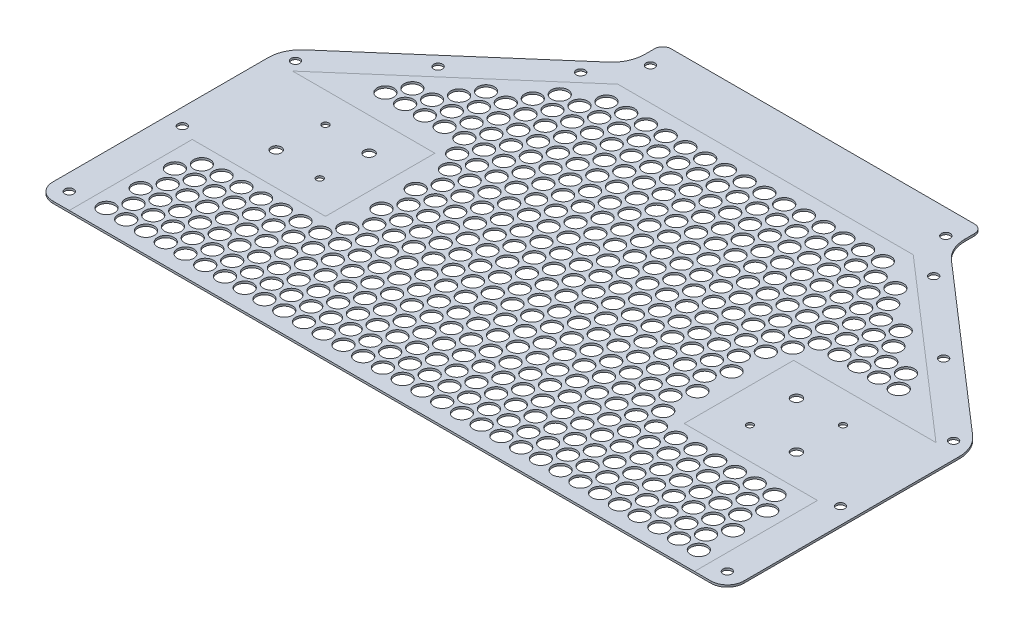
from build123d import *

# Parameters (mm, degrees)
BOSS_EXTRUDE1_DEPTH     = 1.5875
SKETCH3_R               = 3.3782
CUT_EXTRUDE1_DEPTH      = 433.407608347
CUT_EXTRUDE2_DEPTH      = 433.407608347
CUT_EXTRUDE3_DEPTH      = 433.407608347
FILLET3_R               = 12.7
FILLET4_R               = 6.35
SKETCH7_R               = 3.3782
CUT_EXTRUDE4_DEPTH      = 433.407608347
FILLET6_R               = 25.4
FILL_PATTERN2_OUTLINE_R = 6.35
FILL_PATTERN2_DEPTH     = 1.5875


# Read off the part's stored shape, not the designer's step: Fill Pattern2
with BuildPart() as part:
    # Sketch2 → Boss-Extrude1 (new body)
    with BuildSketch(Plane(origin=(0, 0, 0), x_dir=(1, 0, 0), z_dir=(0, 1, 0))):
        Polygon((-266.7, -149.86), (-266.7, -340.36), (266.7, -340.36), (266.7, -149.86), (123.525148037, -25.4), (123.525148037, 0), (-123.525148037, 0), (-123.525148037, -25.4), align=None)
    extrude(amount=BOSS_EXTRUDE1_DEPTH)

    # Sketch3 → Cut-Extrude1 (cut, through all)
    with BuildSketch(Plane(origin=(0, 1.5875, 0), x_dir=(1, 0, 0), z_dir=(0, 1, 0))):
        with Locations(Location((-114.000148037, -19.05, 0), (0, 0, 270))):
            Circle(SKETCH3_R)
        with Locations(Location((114.000148037, -19.05, 0), (0, 0, 270))):
            Circle(SKETCH3_R)
    extrude(amount=-CUT_EXTRUDE1_DEPTH, mode=Mode.SUBTRACT)

    # Sketch4 → Cut-Extrude2 (cut, through all)
    with BuildSketch(Plane(origin=(0, 1.5875, 0), x_dir=(1, 0, 0), z_dir=(0, 1, 0))):
        with BuildLine():
            ThreePointArc((-200.628401657, -223.766605504), (-198.165431662, -218.723220537), (-203.208816629, -216.260250542))
            ThreePointArc((-203.208816629, -216.260250542), (-205.671786625, -221.303635509), (-200.628401657, -223.766605504))
        make_face()
        with BuildLine():
            ThreePointArc((-166.224702763, -224.786406613), (-163.518774508, -222.39673993), (-165.908441191, -219.690811674))
            ThreePointArc((-165.908441191, -219.690811674), (-168.614369446, -222.080478357), (-166.224702763, -224.786406613))
        make_face()
        with BuildLine():
            ThreePointArc((-199.851558809, -186.709188326), (-197.145630554, -184.319521643), (-199.535297237, -181.613593387))
            ThreePointArc((-199.535297237, -181.613593387), (-202.241225492, -184.00326007), (-199.851558809, -186.709188326))
        make_face()
        with BuildLine():
            ThreePointArc((-162.551183371, -190.139749458), (-160.088213375, -185.096364491), (-165.131598343, -182.633394496))
            ThreePointArc((-165.131598343, -182.633394496), (-167.594568338, -187.676779463), (-162.551183371, -190.139749458))
        make_face()
    extrude(amount=-CUT_EXTRUDE2_DEPTH, mode=Mode.SUBTRACT)

    # Sketch6 → Cut-Extrude3 (cut, through all)
    with BuildSketch(Plane(origin=(0, 1.5875, 0), x_dir=(1, 0, 0), z_dir=(0, 1, 0))):
        with BuildLine():
            ThreePointArc((204.506557827, -219.640286491), (199.320286491, -217.494466657), (197.174466657, -222.680737993))
            ThreePointArc((197.174466657, -222.680737993), (202.360737993, -224.826557827), (204.506557827, -219.640286491))
        make_face()
        with BuildLine():
            ThreePointArc((161.253442173, -186.759713509), (166.439713509, -188.905533343), (168.585533343, -183.719262007))
            ThreePointArc((168.585533343, -183.719262007), (163.399262007, -181.573442173), (161.253442173, -186.759713509))
        make_face()
        with BuildLine():
            ThreePointArc((203.393212242, -185.239487758), (200.840512242, -182.686787758), (198.287812242, -185.239487758))
            ThreePointArc((198.287812242, -185.239487758), (200.840512242, -187.792187758), (203.393212242, -185.239487758))
        make_face()
        with BuildLine():
            ThreePointArc((162.366787758, -221.160512242), (164.919487758, -223.713212242), (167.472187758, -221.160512242))
            ThreePointArc((167.472187758, -221.160512242), (164.919487758, -218.607812242), (162.366787758, -221.160512242))
        make_face()
    extrude(amount=-CUT_EXTRUDE3_DEPTH, mode=Mode.SUBTRACT)

    # Fillet3
    fillet3_edges = [part.edges().sort_by_distance(p)[0] for p in [
        (266.7, 0.79375, 340.36),
        (-266.7, 0.79375, 340.36),
    ]]
    fillet(fillet3_edges, radius=FILLET3_R)

    # Fillet4
    fillet4_edges = [part.edges().sort_by_distance(p)[0] for p in [
        (-123.525148037, 0.79375, 0),
        (123.525148037, 0.79375, 0),
    ]]
    fillet(fillet4_edges, radius=FILLET4_R)

    # Sketch7 → Cut-Extrude4 (cut, through all)
    with BuildSketch(Plane(origin=(0, 1.5875, 0), x_dir=(1, 0, 0), z_dir=(0, 1, 0))):
        with Locations(Location((-254, -327.66, 0), (0, 0, 270))):
            Circle(SKETCH7_R)
        with Locations(Location((-254, -240.3475, 0), (0, 0, 270))):
            Circle(SKETCH7_R)
        with Locations(Location((-254, -153.035, 0), (0, 0, 270))):
            Circle(SKETCH7_R)
        with Locations(Location((-136.225148037, -50.654883141, 0), (0, 0, 270))):
            Circle(SKETCH7_R)
        with Locations(Location((254, -327.66, 0), (0, 0, 90))):
            Circle(SKETCH7_R)
        with Locations(Location((254, -240.3475, 0), (0, 0, 90))):
            Circle(SKETCH7_R)
        with Locations(Location((254, -153.035, 0), (0, 0, 90))):
            Circle(SKETCH7_R)
        with Locations(Location((136.225148037, -50.654883141, 0), (0, 0, 90))):
            Circle(SKETCH7_R)
        with Locations(Location((-195.112574019, -101.84494157, 0), (0, 0, 270))):
            Circle(SKETCH7_R)
        with Locations(Location((195.112574019, -101.84494157, 0), (0, 0, 90))):
            Circle(SKETCH7_R)
    extrude(amount=-CUT_EXTRUDE4_DEPTH, mode=Mode.SUBTRACT)

    # Fillet6
    fillet6_edges = [part.edges().sort_by_distance(p)[0] for p in [
        (-123.525148037, 0.79375, 25.4),
        (123.525148037, 0.79375, 25.4),
        (266.7, 0.79375, 149.86),
        (-266.7, 0.79375, 149.86),
    ]]
    fillet(fillet6_edges, radius=FILLET6_R)

    # Fill Pattern2 outline → Fill Pattern2 (cut)
    with BuildSketch(Plane(origin=(0, 0, 0), x_dir=(1, 0, 0), z_dir=(0, 1, 0))):
        with Locations((228.6, -324.274754934)):
            Circle(FILL_PATTERN2_OUTLINE_R)
        with Locations((22.86, -231.887164858)):
            Circle(FILL_PATTERN2_OUTLINE_R)
        with Locations((15.24, -218.688937705)):
            Circle(FILL_PATTERN2_OUTLINE_R)
        with Locations((0, -218.688937705)):
            Circle(FILL_PATTERN2_OUTLINE_R)
        with Locations((-15.24, -218.688937705)):
            Circle(FILL_PATTERN2_OUTLINE_R)
        with Locations((-30.48, -218.688937705)):
            Circle(FILL_PATTERN2_OUTLINE_R)
        with Locations((-45.72, -218.688937705)):
            Circle(FILL_PATTERN2_OUTLINE_R)
        with Locations((-60.96, -218.688937705)):
            Circle(FILL_PATTERN2_OUTLINE_R)
        with Locations((-76.2, -218.688937705)):
            Circle(FILL_PATTERN2_OUTLINE_R)
        with Locations((60.96, -271.481846319)):
            Circle(FILL_PATTERN2_OUTLINE_R)
        with Locations((45.72, -324.274754934)):
            Circle(FILL_PATTERN2_OUTLINE_R)
        with Locations((-220.98, -311.07652778)):
            Circle(FILL_PATTERN2_OUTLINE_R)
        with Locations((-198.12, -297.878300627)):
            Circle(FILL_PATTERN2_OUTLINE_R)
        with Locations((-167.64, -271.481846319)):
            Circle(FILL_PATTERN2_OUTLINE_R)
        with Locations((-121.92, -218.688937705)):
            Circle(FILL_PATTERN2_OUTLINE_R)
        with Locations((-106.68, -218.688937705)):
            Circle(FILL_PATTERN2_OUTLINE_R)
        with Locations((-91.44, -218.688937705)):
            Circle(FILL_PATTERN2_OUTLINE_R)
        with Locations((-160.02, -258.283619166)):
            Circle(FILL_PATTERN2_OUTLINE_R)
        with Locations((-190.5, -284.680073473)):
            Circle(FILL_PATTERN2_OUTLINE_R)
        with Locations((-213.36, -297.878300627)):
            Circle(FILL_PATTERN2_OUTLINE_R)
        with Locations((53.34, -311.07652778)):
            Circle(FILL_PATTERN2_OUTLINE_R)
        with Locations((68.58, -258.283619166)):
            Circle(FILL_PATTERN2_OUTLINE_R)
        with Locations((53.34, -258.283619166)):
            Circle(FILL_PATTERN2_OUTLINE_R)
        with Locations((45.72, -245.085392012)):
            Circle(FILL_PATTERN2_OUTLINE_R)
        with Locations((38.1, -231.887164858)):
            Circle(FILL_PATTERN2_OUTLINE_R)
        with Locations((-114.3, -205.490710551)):
            Circle(FILL_PATTERN2_OUTLINE_R)
        with Locations((-99.06, -205.490710551)):
            Circle(FILL_PATTERN2_OUTLINE_R)
        with Locations((-83.82, -205.490710551)):
            Circle(FILL_PATTERN2_OUTLINE_R)
        with Locations((-68.58, -205.490710551)):
            Circle(FILL_PATTERN2_OUTLINE_R)
        with Locations((-53.34, -205.490710551)):
            Circle(FILL_PATTERN2_OUTLINE_R)
        with Locations((-38.1, -205.490710551)):
            Circle(FILL_PATTERN2_OUTLINE_R)
        with Locations((-22.86, -205.490710551)):
            Circle(FILL_PATTERN2_OUTLINE_R)
        with Locations((-7.62, -205.490710551)):
            Circle(FILL_PATTERN2_OUTLINE_R)
        with Locations((30.48, -271.481846319)):
            Circle(FILL_PATTERN2_OUTLINE_R)
        with Locations((38.1, -284.680073473)):
            Circle(FILL_PATTERN2_OUTLINE_R)
        with Locations((53.34, -284.680073473)):
            Circle(FILL_PATTERN2_OUTLINE_R)
        with Locations((-228.6, -324.274754934)):
            Circle(FILL_PATTERN2_OUTLINE_R)
        with Locations((22.86, -258.283619166)):
            Circle(FILL_PATTERN2_OUTLINE_R)
        with Locations((7.62, -258.283619166)):
            Circle(FILL_PATTERN2_OUTLINE_R)
        with Locations((0, -245.085392012)):
            Circle(FILL_PATTERN2_OUTLINE_R)
        with Locations((-15.24, -245.085392012)):
            Circle(FILL_PATTERN2_OUTLINE_R)
        with Locations((-30.48, -245.085392012)):
            Circle(FILL_PATTERN2_OUTLINE_R)
        with Locations((-45.72, -245.085392012)):
            Circle(FILL_PATTERN2_OUTLINE_R)
        with Locations((-60.96, -245.085392012)):
            Circle(FILL_PATTERN2_OUTLINE_R)
        with Locations((-76.2, -245.085392012)):
            Circle(FILL_PATTERN2_OUTLINE_R)
        with Locations((-91.44, -245.085392012)):
            Circle(FILL_PATTERN2_OUTLINE_R)
        with Locations((-106.68, -245.085392012)):
            Circle(FILL_PATTERN2_OUTLINE_R)
        with Locations((-121.92, -245.085392012)):
            Circle(FILL_PATTERN2_OUTLINE_R)
        with Locations((-152.4, -271.481846319)):
            Circle(FILL_PATTERN2_OUTLINE_R)
        with Locations((-205.74, -311.07652778)):
            Circle(FILL_PATTERN2_OUTLINE_R)
        with Locations((-175.26, -284.680073473)):
            Circle(FILL_PATTERN2_OUTLINE_R)
        with Locations((-144.78, -258.283619166)):
            Circle(FILL_PATTERN2_OUTLINE_R)
        with Locations((-114.3, -231.887164858)):
            Circle(FILL_PATTERN2_OUTLINE_R)
        with Locations((-99.06, -231.887164858)):
            Circle(FILL_PATTERN2_OUTLINE_R)
        with Locations((-83.82, -231.887164858)):
            Circle(FILL_PATTERN2_OUTLINE_R)
        with Locations((-68.58, -231.887164858)):
            Circle(FILL_PATTERN2_OUTLINE_R)
        with Locations((-53.34, -231.887164858)):
            Circle(FILL_PATTERN2_OUTLINE_R)
        with Locations((-38.1, -231.887164858)):
            Circle(FILL_PATTERN2_OUTLINE_R)
        with Locations((-22.86, -231.887164858)):
            Circle(FILL_PATTERN2_OUTLINE_R)
        with Locations((-7.62, -231.887164858)):
            Circle(FILL_PATTERN2_OUTLINE_R)
        with Locations((7.62, -231.887164858)):
            Circle(FILL_PATTERN2_OUTLINE_R)
        with Locations((15.24, -245.085392012)):
            Circle(FILL_PATTERN2_OUTLINE_R)
        with Locations((30.48, -245.085392012)):
            Circle(FILL_PATTERN2_OUTLINE_R)
        with Locations((38.1, -258.283619166)):
            Circle(FILL_PATTERN2_OUTLINE_R)
        with Locations((45.72, -271.481846319)):
            Circle(FILL_PATTERN2_OUTLINE_R)
        with Locations((-114.3, -179.094256244)):
            Circle(FILL_PATTERN2_OUTLINE_R)
        with Locations((-99.06, -179.094256244)):
            Circle(FILL_PATTERN2_OUTLINE_R)
        with Locations((-83.82, -179.094256244)):
            Circle(FILL_PATTERN2_OUTLINE_R)
        with Locations((-68.58, -179.094256244)):
            Circle(FILL_PATTERN2_OUTLINE_R)
        with Locations((-53.34, -179.094256244)):
            Circle(FILL_PATTERN2_OUTLINE_R)
        with Locations((-38.1, -179.094256244)):
            Circle(FILL_PATTERN2_OUTLINE_R)
        with Locations((-22.86, -179.094256244)):
            Circle(FILL_PATTERN2_OUTLINE_R)
        with Locations((-7.62, -179.094256244)):
            Circle(FILL_PATTERN2_OUTLINE_R)
        with Locations((7.62, -179.094256244)):
            Circle(FILL_PATTERN2_OUTLINE_R)
        with Locations((22.86, -179.094256244)):
            Circle(FILL_PATTERN2_OUTLINE_R)
        with Locations((38.1, -179.094256244)):
            Circle(FILL_PATTERN2_OUTLINE_R)
        with Locations((45.72, -192.292483397)):
            Circle(FILL_PATTERN2_OUTLINE_R)
        with Locations((60.96, -192.292483397)):
            Circle(FILL_PATTERN2_OUTLINE_R)
        with Locations((68.58, -205.490710551)):
            Circle(FILL_PATTERN2_OUTLINE_R)
        with Locations((76.2, -218.688937705)):
            Circle(FILL_PATTERN2_OUTLINE_R)
        with Locations((91.44, -218.688937705)):
            Circle(FILL_PATTERN2_OUTLINE_R)
        with Locations((30.48, -165.89602909)):
            Circle(FILL_PATTERN2_OUTLINE_R)
        with Locations((15.24, -165.89602909)):
            Circle(FILL_PATTERN2_OUTLINE_R)
        with Locations((0, -165.89602909)):
            Circle(FILL_PATTERN2_OUTLINE_R)
        with Locations((-15.24, -165.89602909)):
            Circle(FILL_PATTERN2_OUTLINE_R)
        with Locations((-30.48, -165.89602909)):
            Circle(FILL_PATTERN2_OUTLINE_R)
        with Locations((-45.72, -165.89602909)):
            Circle(FILL_PATTERN2_OUTLINE_R)
        with Locations((-60.96, -165.89602909)):
            Circle(FILL_PATTERN2_OUTLINE_R)
        with Locations((-76.2, -165.89602909)):
            Circle(FILL_PATTERN2_OUTLINE_R)
        with Locations((-91.44, -165.89602909)):
            Circle(FILL_PATTERN2_OUTLINE_R)
        with Locations((-106.68, -165.89602909)):
            Circle(FILL_PATTERN2_OUTLINE_R)
        with Locations((-121.92, -165.89602909)):
            Circle(FILL_PATTERN2_OUTLINE_R)
        with Locations((-190.5, -258.283619166)):
            Circle(FILL_PATTERN2_OUTLINE_R)
        with Locations((-213.36, -271.481846319)):
            Circle(FILL_PATTERN2_OUTLINE_R)
        with Locations((-228.6, -271.481846319)):
            Circle(FILL_PATTERN2_OUTLINE_R)
        with Locations((68.58, -311.07652778)):
            Circle(FILL_PATTERN2_OUTLINE_R)
        with Locations((76.2, -271.481846319)):
            Circle(FILL_PATTERN2_OUTLINE_R)
        with Locations((7.62, -205.490710551)):
            Circle(FILL_PATTERN2_OUTLINE_R)
        with Locations((22.86, -205.490710551)):
            Circle(FILL_PATTERN2_OUTLINE_R)
        with Locations((30.48, -218.688937705)):
            Circle(FILL_PATTERN2_OUTLINE_R)
        with Locations((45.72, -218.688937705)):
            Circle(FILL_PATTERN2_OUTLINE_R)
        with Locations((60.96, -297.878300627)):
            Circle(FILL_PATTERN2_OUTLINE_R)
        with Locations((76.2, -245.085392012)):
            Circle(FILL_PATTERN2_OUTLINE_R)
        with Locations((60.96, -245.085392012)):
            Circle(FILL_PATTERN2_OUTLINE_R)
        with Locations((53.34, -231.887164858)):
            Circle(FILL_PATTERN2_OUTLINE_R)
        with Locations((-228.6, -297.878300627)):
            Circle(FILL_PATTERN2_OUTLINE_R)
        with Locations((-205.74, -284.680073473)):
            Circle(FILL_PATTERN2_OUTLINE_R)
        with Locations((-182.88, -271.481846319)):
            Circle(FILL_PATTERN2_OUTLINE_R)
        with Locations((-121.92, -192.292483397)):
            Circle(FILL_PATTERN2_OUTLINE_R)
        with Locations((-106.68, -192.292483397)):
            Circle(FILL_PATTERN2_OUTLINE_R)
        with Locations((-91.44, -192.292483397)):
            Circle(FILL_PATTERN2_OUTLINE_R)
        with Locations((-76.2, -192.292483397)):
            Circle(FILL_PATTERN2_OUTLINE_R)
        with Locations((-60.96, -192.292483397)):
            Circle(FILL_PATTERN2_OUTLINE_R)
        with Locations((-45.72, -192.292483397)):
            Circle(FILL_PATTERN2_OUTLINE_R)
        with Locations((-30.48, -192.292483397)):
            Circle(FILL_PATTERN2_OUTLINE_R)
        with Locations((-15.24, -192.292483397)):
            Circle(FILL_PATTERN2_OUTLINE_R)
        with Locations((0, -192.292483397)):
            Circle(FILL_PATTERN2_OUTLINE_R)
        with Locations((15.24, -192.292483397)):
            Circle(FILL_PATTERN2_OUTLINE_R)
        with Locations((30.48, -192.292483397)):
            Circle(FILL_PATTERN2_OUTLINE_R)
        with Locations((38.1, -205.490710551)):
            Circle(FILL_PATTERN2_OUTLINE_R)
        with Locations((53.34, -205.490710551)):
            Circle(FILL_PATTERN2_OUTLINE_R)
        with Locations((-175.26, -258.283619166)):
            Circle(FILL_PATTERN2_OUTLINE_R)
        with Locations((-198.12, -271.481846319)):
            Circle(FILL_PATTERN2_OUTLINE_R)
        with Locations((-220.98, -284.680073473)):
            Circle(FILL_PATTERN2_OUTLINE_R)
        with Locations((60.96, -324.274754934)):
            Circle(FILL_PATTERN2_OUTLINE_R)
        with Locations((60.96, -218.688937705)):
            Circle(FILL_PATTERN2_OUTLINE_R)
        with Locations((68.58, -231.887164858)):
            Circle(FILL_PATTERN2_OUTLINE_R)
        with Locations((83.82, -231.887164858)):
            Circle(FILL_PATTERN2_OUTLINE_R)
        with Locations((68.58, -284.680073473)):
            Circle(FILL_PATTERN2_OUTLINE_R)
        with Locations((-76.2, -324.274754934)):
            Circle(FILL_PATTERN2_OUTLINE_R)
        with Locations((-60.96, -324.274754934)):
            Circle(FILL_PATTERN2_OUTLINE_R)
        with Locations((-45.72, -324.274754934)):
            Circle(FILL_PATTERN2_OUTLINE_R)
        with Locations((-160.02, -311.07652778)):
            Circle(FILL_PATTERN2_OUTLINE_R)
        with Locations((-91.44, -324.274754934)):
            Circle(FILL_PATTERN2_OUTLINE_R)
        with Locations((-106.68, -324.274754934)):
            Circle(FILL_PATTERN2_OUTLINE_R)
        with Locations((-121.92, -324.274754934)):
            Circle(FILL_PATTERN2_OUTLINE_R)
        with Locations((-137.16, -324.274754934)):
            Circle(FILL_PATTERN2_OUTLINE_R)
        with Locations((-144.78, -311.07652778)):
            Circle(FILL_PATTERN2_OUTLINE_R)
        with Locations((-129.54, -311.07652778)):
            Circle(FILL_PATTERN2_OUTLINE_R)
        with Locations((-114.3, -311.07652778)):
            Circle(FILL_PATTERN2_OUTLINE_R)
        with Locations((-99.06, -311.07652778)):
            Circle(FILL_PATTERN2_OUTLINE_R)
        with Locations((-83.82, -311.07652778)):
            Circle(FILL_PATTERN2_OUTLINE_R)
        with Locations((-68.58, -311.07652778)):
            Circle(FILL_PATTERN2_OUTLINE_R)
        with Locations((-53.34, -311.07652778)):
            Circle(FILL_PATTERN2_OUTLINE_R)
        with Locations((-38.1, -311.07652778)):
            Circle(FILL_PATTERN2_OUTLINE_R)
        with Locations((-152.4, -324.274754934)):
            Circle(FILL_PATTERN2_OUTLINE_R)
        with Locations((-167.64, -324.274754934)):
            Circle(FILL_PATTERN2_OUTLINE_R)
        with Locations((-15.24, -271.481846319)):
            Circle(FILL_PATTERN2_OUTLINE_R)
        with Locations((-7.62, -284.680073473)):
            Circle(FILL_PATTERN2_OUTLINE_R)
        with Locations((7.62, -284.680073473)):
            Circle(FILL_PATTERN2_OUTLINE_R)
        with Locations((15.24, -297.878300627)):
            Circle(FILL_PATTERN2_OUTLINE_R)
        with Locations((22.86, -311.07652778)):
            Circle(FILL_PATTERN2_OUTLINE_R)
        with Locations((38.1, -311.07652778)):
            Circle(FILL_PATTERN2_OUTLINE_R)
        with Locations((-190.5, -311.07652778)):
            Circle(FILL_PATTERN2_OUTLINE_R)
        with Locations((-160.02, -284.680073473)):
            Circle(FILL_PATTERN2_OUTLINE_R)
        with Locations((-30.48, -271.481846319)):
            Circle(FILL_PATTERN2_OUTLINE_R)
        with Locations((-45.72, -271.481846319)):
            Circle(FILL_PATTERN2_OUTLINE_R)
        with Locations((-60.96, -271.481846319)):
            Circle(FILL_PATTERN2_OUTLINE_R)
        with Locations((-76.2, -271.481846319)):
            Circle(FILL_PATTERN2_OUTLINE_R)
        with Locations((-91.44, -271.481846319)):
            Circle(FILL_PATTERN2_OUTLINE_R)
        with Locations((-106.68, -271.481846319)):
            Circle(FILL_PATTERN2_OUTLINE_R)
        with Locations((-121.92, -271.481846319)):
            Circle(FILL_PATTERN2_OUTLINE_R)
        with Locations((-137.16, -271.481846319)):
            Circle(FILL_PATTERN2_OUTLINE_R)
        with Locations((-182.88, -297.878300627)):
            Circle(FILL_PATTERN2_OUTLINE_R)
        with Locations((-213.36, -324.274754934)):
            Circle(FILL_PATTERN2_OUTLINE_R)
        with Locations((45.72, -297.878300627)):
            Circle(FILL_PATTERN2_OUTLINE_R)
        with Locations((30.48, -297.878300627)):
            Circle(FILL_PATTERN2_OUTLINE_R)
        with Locations((22.86, -284.680073473)):
            Circle(FILL_PATTERN2_OUTLINE_R)
        with Locations((15.24, -271.481846319)):
            Circle(FILL_PATTERN2_OUTLINE_R)
        with Locations((0, -271.481846319)):
            Circle(FILL_PATTERN2_OUTLINE_R)
        with Locations((-7.62, -258.283619166)):
            Circle(FILL_PATTERN2_OUTLINE_R)
        with Locations((-22.86, -258.283619166)):
            Circle(FILL_PATTERN2_OUTLINE_R)
        with Locations((-38.1, -258.283619166)):
            Circle(FILL_PATTERN2_OUTLINE_R)
        with Locations((-53.34, -258.283619166)):
            Circle(FILL_PATTERN2_OUTLINE_R)
        with Locations((-68.58, -258.283619166)):
            Circle(FILL_PATTERN2_OUTLINE_R)
        with Locations((-83.82, -258.283619166)):
            Circle(FILL_PATTERN2_OUTLINE_R)
        with Locations((-99.06, -258.283619166)):
            Circle(FILL_PATTERN2_OUTLINE_R)
        with Locations((-114.3, -258.283619166)):
            Circle(FILL_PATTERN2_OUTLINE_R)
        with Locations((-129.54, -258.283619166)):
            Circle(FILL_PATTERN2_OUTLINE_R)
        with Locations((-22.86, -311.07652778)):
            Circle(FILL_PATTERN2_OUTLINE_R)
        with Locations((-7.62, -311.07652778)):
            Circle(FILL_PATTERN2_OUTLINE_R)
        with Locations((0, -324.274754934)):
            Circle(FILL_PATTERN2_OUTLINE_R)
        with Locations((-175.26, -311.07652778)):
            Circle(FILL_PATTERN2_OUTLINE_R)
        with Locations((-30.48, -297.878300627)):
            Circle(FILL_PATTERN2_OUTLINE_R)
        with Locations((-45.72, -297.878300627)):
            Circle(FILL_PATTERN2_OUTLINE_R)
        with Locations((-60.96, -297.878300627)):
            Circle(FILL_PATTERN2_OUTLINE_R)
        with Locations((-76.2, -297.878300627)):
            Circle(FILL_PATTERN2_OUTLINE_R)
        with Locations((-30.48, -324.274754934)):
            Circle(FILL_PATTERN2_OUTLINE_R)
        with Locations((-15.24, -324.274754934)):
            Circle(FILL_PATTERN2_OUTLINE_R)
        with Locations((-182.88, -324.274754934)):
            Circle(FILL_PATTERN2_OUTLINE_R)
        with Locations((-152.4, -297.878300627)):
            Circle(FILL_PATTERN2_OUTLINE_R)
        with Locations((-137.16, -297.878300627)):
            Circle(FILL_PATTERN2_OUTLINE_R)
        with Locations((-121.92, -297.878300627)):
            Circle(FILL_PATTERN2_OUTLINE_R)
        with Locations((-106.68, -297.878300627)):
            Circle(FILL_PATTERN2_OUTLINE_R)
        with Locations((-91.44, -297.878300627)):
            Circle(FILL_PATTERN2_OUTLINE_R)
        with Locations((-22.86, -284.680073473)):
            Circle(FILL_PATTERN2_OUTLINE_R)
        with Locations((-15.24, -297.878300627)):
            Circle(FILL_PATTERN2_OUTLINE_R)
        with Locations((0, -297.878300627)):
            Circle(FILL_PATTERN2_OUTLINE_R)
        with Locations((7.62, -311.07652778)):
            Circle(FILL_PATTERN2_OUTLINE_R)
        with Locations((15.24, -324.274754934)):
            Circle(FILL_PATTERN2_OUTLINE_R)
        with Locations((30.48, -324.274754934)):
            Circle(FILL_PATTERN2_OUTLINE_R)
        with Locations((-198.12, -324.274754934)):
            Circle(FILL_PATTERN2_OUTLINE_R)
        with Locations((-167.64, -297.878300627)):
            Circle(FILL_PATTERN2_OUTLINE_R)
        with Locations((-38.1, -284.680073473)):
            Circle(FILL_PATTERN2_OUTLINE_R)
        with Locations((-53.34, -284.680073473)):
            Circle(FILL_PATTERN2_OUTLINE_R)
        with Locations((-68.58, -284.680073473)):
            Circle(FILL_PATTERN2_OUTLINE_R)
        with Locations((-83.82, -284.680073473)):
            Circle(FILL_PATTERN2_OUTLINE_R)
        with Locations((-99.06, -284.680073473)):
            Circle(FILL_PATTERN2_OUTLINE_R)
        with Locations((-114.3, -284.680073473)):
            Circle(FILL_PATTERN2_OUTLINE_R)
        with Locations((-129.54, -284.680073473)):
            Circle(FILL_PATTERN2_OUTLINE_R)
        with Locations((-144.78, -284.680073473)):
            Circle(FILL_PATTERN2_OUTLINE_R)
        with Locations((-30.48, -86.706666168)):
            Circle(FILL_PATTERN2_OUTLINE_R)
        with Locations((-15.24, -86.706666168)):
            Circle(FILL_PATTERN2_OUTLINE_R)
        with Locations((0, -86.706666168)):
            Circle(FILL_PATTERN2_OUTLINE_R)
        with Locations((15.24, -86.706666168)):
            Circle(FILL_PATTERN2_OUTLINE_R)
        with Locations((30.48, -86.706666168)):
            Circle(FILL_PATTERN2_OUTLINE_R)
        with Locations((45.72, -86.706666168)):
            Circle(FILL_PATTERN2_OUTLINE_R)
        with Locations((60.96, -86.706666168)):
            Circle(FILL_PATTERN2_OUTLINE_R)
        with Locations((76.2, -86.706666168)):
            Circle(FILL_PATTERN2_OUTLINE_R)
        with Locations((91.44, -86.706666168)):
            Circle(FILL_PATTERN2_OUTLINE_R)
        with Locations((99.06, -99.904893322)):
            Circle(FILL_PATTERN2_OUTLINE_R)
        with Locations((114.3, -99.904893322)):
            Circle(FILL_PATTERN2_OUTLINE_R)
        with Locations((121.92, -113.103120475)):
            Circle(FILL_PATTERN2_OUTLINE_R)
        with Locations((129.54, -126.301347629)):
            Circle(FILL_PATTERN2_OUTLINE_R)
        with Locations((144.78, -126.301347629)):
            Circle(FILL_PATTERN2_OUTLINE_R)
        with Locations((152.4, -139.499574783)):
            Circle(FILL_PATTERN2_OUTLINE_R)
        with Locations((121.92, -218.688937705)):
            Circle(FILL_PATTERN2_OUTLINE_R)
        with Locations((-83.82, -73.508439014)):
            Circle(FILL_PATTERN2_OUTLINE_R)
        with Locations((-99.06, -73.508439014)):
            Circle(FILL_PATTERN2_OUTLINE_R)
        with Locations((-114.3, -73.508439014)):
            Circle(FILL_PATTERN2_OUTLINE_R)
        with Locations((-137.16, -86.706666168)):
            Circle(FILL_PATTERN2_OUTLINE_R)
        with Locations((-167.64, -113.103120475)):
            Circle(FILL_PATTERN2_OUTLINE_R)
        with Locations((-198.12, -139.499574783)):
            Circle(FILL_PATTERN2_OUTLINE_R)
        with Locations((213.36, -324.274754934)):
            Circle(FILL_PATTERN2_OUTLINE_R)
        with Locations((213.36, -297.878300627)):
            Circle(FILL_PATTERN2_OUTLINE_R)
        with Locations((205.74, -284.680073473)):
            Circle(FILL_PATTERN2_OUTLINE_R)
        with Locations((190.5, -284.680073473)):
            Circle(FILL_PATTERN2_OUTLINE_R)
        with Locations((175.26, -284.680073473)):
            Circle(FILL_PATTERN2_OUTLINE_R)
        with Locations((160.02, -284.680073473)):
            Circle(FILL_PATTERN2_OUTLINE_R)
        with Locations((144.78, -284.680073473)):
            Circle(FILL_PATTERN2_OUTLINE_R)
        with Locations((129.54, -284.680073473)):
            Circle(FILL_PATTERN2_OUTLINE_R)
        with Locations((121.92, -271.481846319)):
            Circle(FILL_PATTERN2_OUTLINE_R)
        with Locations((121.92, -245.085392012)):
            Circle(FILL_PATTERN2_OUTLINE_R)
        with Locations((-22.86, -99.904893322)):
            Circle(FILL_PATTERN2_OUTLINE_R)
        with Locations((-7.62, -99.904893322)):
            Circle(FILL_PATTERN2_OUTLINE_R)
        with Locations((7.62, -99.904893322)):
            Circle(FILL_PATTERN2_OUTLINE_R)
        with Locations((22.86, -99.904893322)):
            Circle(FILL_PATTERN2_OUTLINE_R)
        with Locations((38.1, -99.904893322)):
            Circle(FILL_PATTERN2_OUTLINE_R)
        with Locations((53.34, -99.904893322)):
            Circle(FILL_PATTERN2_OUTLINE_R)
        with Locations((68.58, -99.904893322)):
            Circle(FILL_PATTERN2_OUTLINE_R)
        with Locations((83.82, -99.904893322)):
            Circle(FILL_PATTERN2_OUTLINE_R)
        with Locations((114.3, -258.283619166)):
            Circle(FILL_PATTERN2_OUTLINE_R)
        with Locations((114.3, -231.887164858)):
            Circle(FILL_PATTERN2_OUTLINE_R)
        with Locations((121.92, -192.292483397)):
            Circle(FILL_PATTERN2_OUTLINE_R)
        with Locations((137.16, -139.499574783)):
            Circle(FILL_PATTERN2_OUTLINE_R)
        with Locations((121.92, -139.499574783)):
            Circle(FILL_PATTERN2_OUTLINE_R)
        with Locations((114.3, -126.301347629)):
            Circle(FILL_PATTERN2_OUTLINE_R)
        with Locations((106.68, -113.103120475)):
            Circle(FILL_PATTERN2_OUTLINE_R)
        with Locations((91.44, -113.103120475)):
            Circle(FILL_PATTERN2_OUTLINE_R)
        with Locations((114.3, -284.680073473)):
            Circle(FILL_PATTERN2_OUTLINE_R)
        with Locations((121.92, -297.878300627)):
            Circle(FILL_PATTERN2_OUTLINE_R)
        with Locations((137.16, -297.878300627)):
            Circle(FILL_PATTERN2_OUTLINE_R)
        with Locations((152.4, -297.878300627)):
            Circle(FILL_PATTERN2_OUTLINE_R)
        with Locations((167.64, -297.878300627)):
            Circle(FILL_PATTERN2_OUTLINE_R)
        with Locations((182.88, -297.878300627)):
            Circle(FILL_PATTERN2_OUTLINE_R)
        with Locations((198.12, -297.878300627)):
            Circle(FILL_PATTERN2_OUTLINE_R)
        with Locations((205.74, -311.07652778)):
            Circle(FILL_PATTERN2_OUTLINE_R)
        with Locations((-175.26, -126.301347629)):
            Circle(FILL_PATTERN2_OUTLINE_R)
        with Locations((-144.78, -99.904893322)):
            Circle(FILL_PATTERN2_OUTLINE_R)
        with Locations((-121.92, -86.706666168)):
            Circle(FILL_PATTERN2_OUTLINE_R)
        with Locations((-106.68, -86.706666168)):
            Circle(FILL_PATTERN2_OUTLINE_R)
        with Locations((-91.44, -86.706666168)):
            Circle(FILL_PATTERN2_OUTLINE_R)
        with Locations((-76.2, -86.706666168)):
            Circle(FILL_PATTERN2_OUTLINE_R)
        with Locations((-60.96, -86.706666168)):
            Circle(FILL_PATTERN2_OUTLINE_R)
        with Locations((-45.72, -86.706666168)):
            Circle(FILL_PATTERN2_OUTLINE_R)
        with Locations((228.6, -297.878300627)):
            Circle(FILL_PATTERN2_OUTLINE_R)
        with Locations((228.6, -271.481846319)):
            Circle(FILL_PATTERN2_OUTLINE_R)
        with Locations((220.98, -258.283619166)):
            Circle(FILL_PATTERN2_OUTLINE_R)
        with Locations((205.74, -258.283619166)):
            Circle(FILL_PATTERN2_OUTLINE_R)
        with Locations((190.5, -258.283619166)):
            Circle(FILL_PATTERN2_OUTLINE_R)
        with Locations((175.26, -258.283619166)):
            Circle(FILL_PATTERN2_OUTLINE_R)
        with Locations((160.02, -258.283619166)):
            Circle(FILL_PATTERN2_OUTLINE_R)
        with Locations((144.78, -258.283619166)):
            Circle(FILL_PATTERN2_OUTLINE_R)
        with Locations((198.12, -139.499574783)):
            Circle(FILL_PATTERN2_OUTLINE_R)
        with Locations((190.5, -126.301347629)):
            Circle(FILL_PATTERN2_OUTLINE_R)
        with Locations((175.26, -126.301347629)):
            Circle(FILL_PATTERN2_OUTLINE_R)
        with Locations((167.64, -113.103120475)):
            Circle(FILL_PATTERN2_OUTLINE_R)
        with Locations((160.02, -99.904893322)):
            Circle(FILL_PATTERN2_OUTLINE_R)
        with Locations((144.78, -99.904893322)):
            Circle(FILL_PATTERN2_OUTLINE_R)
        with Locations((137.16, -86.706666168)):
            Circle(FILL_PATTERN2_OUTLINE_R)
        with Locations((129.54, -73.508439014)):
            Circle(FILL_PATTERN2_OUTLINE_R)
        with Locations((114.3, -73.508439014)):
            Circle(FILL_PATTERN2_OUTLINE_R)
        with Locations((106.68, -60.31021186)):
            Circle(FILL_PATTERN2_OUTLINE_R)
        with Locations((91.44, -60.31021186)):
            Circle(FILL_PATTERN2_OUTLINE_R)
        with Locations((76.2, -60.31021186)):
            Circle(FILL_PATTERN2_OUTLINE_R)
        with Locations((60.96, -60.31021186)):
            Circle(FILL_PATTERN2_OUTLINE_R)
        with Locations((45.72, -60.31021186)):
            Circle(FILL_PATTERN2_OUTLINE_R)
        with Locations((30.48, -60.31021186)):
            Circle(FILL_PATTERN2_OUTLINE_R)
        with Locations((15.24, -60.31021186)):
            Circle(FILL_PATTERN2_OUTLINE_R)
        with Locations((0, -60.31021186)):
            Circle(FILL_PATTERN2_OUTLINE_R)
        with Locations((-15.24, -60.31021186)):
            Circle(FILL_PATTERN2_OUTLINE_R)
        with Locations((-30.48, -60.31021186)):
            Circle(FILL_PATTERN2_OUTLINE_R)
        with Locations((-45.72, -60.31021186)):
            Circle(FILL_PATTERN2_OUTLINE_R)
        with Locations((-60.96, -60.31021186)):
            Circle(FILL_PATTERN2_OUTLINE_R)
        with Locations((-76.2, -60.31021186)):
            Circle(FILL_PATTERN2_OUTLINE_R)
        with Locations((-91.44, -60.31021186)):
            Circle(FILL_PATTERN2_OUTLINE_R)
        with Locations((-106.68, -60.31021186)):
            Circle(FILL_PATTERN2_OUTLINE_R)
        with Locations((-68.58, -73.508439014)):
            Circle(FILL_PATTERN2_OUTLINE_R)
        with Locations((-53.34, -73.508439014)):
            Circle(FILL_PATTERN2_OUTLINE_R)
        with Locations((-38.1, -73.508439014)):
            Circle(FILL_PATTERN2_OUTLINE_R)
        with Locations((-22.86, -73.508439014)):
            Circle(FILL_PATTERN2_OUTLINE_R)
        with Locations((-7.62, -73.508439014)):
            Circle(FILL_PATTERN2_OUTLINE_R)
        with Locations((7.62, -73.508439014)):
            Circle(FILL_PATTERN2_OUTLINE_R)
        with Locations((22.86, -73.508439014)):
            Circle(FILL_PATTERN2_OUTLINE_R)
        with Locations((38.1, -73.508439014)):
            Circle(FILL_PATTERN2_OUTLINE_R)
        with Locations((53.34, -73.508439014)):
            Circle(FILL_PATTERN2_OUTLINE_R)
        with Locations((68.58, -73.508439014)):
            Circle(FILL_PATTERN2_OUTLINE_R)
        with Locations((83.82, -73.508439014)):
            Circle(FILL_PATTERN2_OUTLINE_R)
        with Locations((99.06, -73.508439014)):
            Circle(FILL_PATTERN2_OUTLINE_R)
        with Locations((106.68, -86.706666168)):
            Circle(FILL_PATTERN2_OUTLINE_R)
        with Locations((121.92, -86.706666168)):
            Circle(FILL_PATTERN2_OUTLINE_R)
        with Locations((129.54, -99.904893322)):
            Circle(FILL_PATTERN2_OUTLINE_R)
        with Locations((137.16, -113.103120475)):
            Circle(FILL_PATTERN2_OUTLINE_R)
        with Locations((182.88, -271.481846319)):
            Circle(FILL_PATTERN2_OUTLINE_R)
        with Locations((198.12, -271.481846319)):
            Circle(FILL_PATTERN2_OUTLINE_R)
        with Locations((213.36, -271.481846319)):
            Circle(FILL_PATTERN2_OUTLINE_R)
        with Locations((220.98, -284.680073473)):
            Circle(FILL_PATTERN2_OUTLINE_R)
        with Locations((220.98, -311.07652778)):
            Circle(FILL_PATTERN2_OUTLINE_R)
        with Locations((-190.5, -126.301347629)):
            Circle(FILL_PATTERN2_OUTLINE_R)
        with Locations((-160.02, -99.904893322)):
            Circle(FILL_PATTERN2_OUTLINE_R)
        with Locations((-129.54, -73.508439014)):
            Circle(FILL_PATTERN2_OUTLINE_R)
        with Locations((167.64, -271.481846319)):
            Circle(FILL_PATTERN2_OUTLINE_R)
        with Locations((152.4, -271.481846319)):
            Circle(FILL_PATTERN2_OUTLINE_R)
        with Locations((137.16, -271.481846319)):
            Circle(FILL_PATTERN2_OUTLINE_R)
        with Locations((129.54, -258.283619166)):
            Circle(FILL_PATTERN2_OUTLINE_R)
        with Locations((182.88, -139.499574783)):
            Circle(FILL_PATTERN2_OUTLINE_R)
        with Locations((167.64, -139.499574783)):
            Circle(FILL_PATTERN2_OUTLINE_R)
        with Locations((160.02, -126.301347629)):
            Circle(FILL_PATTERN2_OUTLINE_R)
        with Locations((152.4, -113.103120475)):
            Circle(FILL_PATTERN2_OUTLINE_R)
        with Locations((-152.4, -139.499574783)):
            Circle(FILL_PATTERN2_OUTLINE_R)
        with Locations((-137.16, -139.499574783)):
            Circle(FILL_PATTERN2_OUTLINE_R)
        with Locations((-121.92, -139.499574783)):
            Circle(FILL_PATTERN2_OUTLINE_R)
        with Locations((-106.68, -139.499574783)):
            Circle(FILL_PATTERN2_OUTLINE_R)
        with Locations((-91.44, -139.499574783)):
            Circle(FILL_PATTERN2_OUTLINE_R)
        with Locations((-76.2, -139.499574783)):
            Circle(FILL_PATTERN2_OUTLINE_R)
        with Locations((-60.96, -139.499574783)):
            Circle(FILL_PATTERN2_OUTLINE_R)
        with Locations((-45.72, -139.499574783)):
            Circle(FILL_PATTERN2_OUTLINE_R)
        with Locations((-30.48, -139.499574783)):
            Circle(FILL_PATTERN2_OUTLINE_R)
        with Locations((-15.24, -139.499574783)):
            Circle(FILL_PATTERN2_OUTLINE_R)
        with Locations((0, -139.499574783)):
            Circle(FILL_PATTERN2_OUTLINE_R)
        with Locations((15.24, -139.499574783)):
            Circle(FILL_PATTERN2_OUTLINE_R)
        with Locations((30.48, -139.499574783)):
            Circle(FILL_PATTERN2_OUTLINE_R)
        with Locations((45.72, -139.499574783)):
            Circle(FILL_PATTERN2_OUTLINE_R)
        with Locations((60.96, -139.499574783)):
            Circle(FILL_PATTERN2_OUTLINE_R)
        with Locations((68.58, -152.697801936)):
            Circle(FILL_PATTERN2_OUTLINE_R)
        with Locations((83.82, -152.697801936)):
            Circle(FILL_PATTERN2_OUTLINE_R)
        with Locations((91.44, -165.89602909)):
            Circle(FILL_PATTERN2_OUTLINE_R)
        with Locations((99.06, -179.094256244)):
            Circle(FILL_PATTERN2_OUTLINE_R)
        with Locations((114.3, -179.094256244)):
            Circle(FILL_PATTERN2_OUTLINE_R)
        with Locations((99.06, -231.887164858)):
            Circle(FILL_PATTERN2_OUTLINE_R)
        with Locations((91.44, -271.481846319)):
            Circle(FILL_PATTERN2_OUTLINE_R)
        with Locations((91.44, -297.878300627)):
            Circle(FILL_PATTERN2_OUTLINE_R)
        with Locations((91.44, -324.274754934)):
            Circle(FILL_PATTERN2_OUTLINE_R)
        with Locations((-167.64, -139.499574783)):
            Circle(FILL_PATTERN2_OUTLINE_R)
        with Locations((-144.78, -126.301347629)):
            Circle(FILL_PATTERN2_OUTLINE_R)
        with Locations((-129.54, -126.301347629)):
            Circle(FILL_PATTERN2_OUTLINE_R)
        with Locations((-114.3, -126.301347629)):
            Circle(FILL_PATTERN2_OUTLINE_R)
        with Locations((-99.06, -126.301347629)):
            Circle(FILL_PATTERN2_OUTLINE_R)
        with Locations((-83.82, -126.301347629)):
            Circle(FILL_PATTERN2_OUTLINE_R)
        with Locations((-68.58, -126.301347629)):
            Circle(FILL_PATTERN2_OUTLINE_R)
        with Locations((-53.34, -126.301347629)):
            Circle(FILL_PATTERN2_OUTLINE_R)
        with Locations((-129.54, -152.697801936)):
            Circle(FILL_PATTERN2_OUTLINE_R)
        with Locations((-205.74, -258.283619166)):
            Circle(FILL_PATTERN2_OUTLINE_R)
        with Locations((-220.98, -258.283619166)):
            Circle(FILL_PATTERN2_OUTLINE_R)
        with Locations((76.2, -324.274754934)):
            Circle(FILL_PATTERN2_OUTLINE_R)
        with Locations((-114.3, -152.697801936)):
            Circle(FILL_PATTERN2_OUTLINE_R)
        with Locations((-99.06, -152.697801936)):
            Circle(FILL_PATTERN2_OUTLINE_R)
        with Locations((-83.82, -152.697801936)):
            Circle(FILL_PATTERN2_OUTLINE_R)
        with Locations((-68.58, -152.697801936)):
            Circle(FILL_PATTERN2_OUTLINE_R)
        with Locations((76.2, -297.878300627)):
            Circle(FILL_PATTERN2_OUTLINE_R)
        with Locations((83.82, -258.283619166)):
            Circle(FILL_PATTERN2_OUTLINE_R)
        with Locations((99.06, -205.490710551)):
            Circle(FILL_PATTERN2_OUTLINE_R)
        with Locations((83.82, -205.490710551)):
            Circle(FILL_PATTERN2_OUTLINE_R)
        with Locations((76.2, -192.292483397)):
            Circle(FILL_PATTERN2_OUTLINE_R)
        with Locations((68.58, -179.094256244)):
            Circle(FILL_PATTERN2_OUTLINE_R)
        with Locations((53.34, -179.094256244)):
            Circle(FILL_PATTERN2_OUTLINE_R)
        with Locations((45.72, -165.89602909)):
            Circle(FILL_PATTERN2_OUTLINE_R)
        with Locations((-53.34, -152.697801936)):
            Circle(FILL_PATTERN2_OUTLINE_R)
        with Locations((-38.1, -152.697801936)):
            Circle(FILL_PATTERN2_OUTLINE_R)
        with Locations((-22.86, -152.697801936)):
            Circle(FILL_PATTERN2_OUTLINE_R)
        with Locations((-7.62, -152.697801936)):
            Circle(FILL_PATTERN2_OUTLINE_R)
        with Locations((7.62, -152.697801936)):
            Circle(FILL_PATTERN2_OUTLINE_R)
        with Locations((22.86, -152.697801936)):
            Circle(FILL_PATTERN2_OUTLINE_R)
        with Locations((38.1, -152.697801936)):
            Circle(FILL_PATTERN2_OUTLINE_R)
        with Locations((53.34, -152.697801936)):
            Circle(FILL_PATTERN2_OUTLINE_R)
        with Locations((83.82, -311.07652778)):
            Circle(FILL_PATTERN2_OUTLINE_R)
        with Locations((83.82, -284.680073473)):
            Circle(FILL_PATTERN2_OUTLINE_R)
        with Locations((91.44, -245.085392012)):
            Circle(FILL_PATTERN2_OUTLINE_R)
        with Locations((106.68, -192.292483397)):
            Circle(FILL_PATTERN2_OUTLINE_R)
        with Locations((91.44, -192.292483397)):
            Circle(FILL_PATTERN2_OUTLINE_R)
        with Locations((83.82, -179.094256244)):
            Circle(FILL_PATTERN2_OUTLINE_R)
        with Locations((76.2, -165.89602909)):
            Circle(FILL_PATTERN2_OUTLINE_R)
        with Locations((60.96, -165.89602909)):
            Circle(FILL_PATTERN2_OUTLINE_R)
        with Locations((-15.24, -113.103120475)):
            Circle(FILL_PATTERN2_OUTLINE_R)
        with Locations((0, -113.103120475)):
            Circle(FILL_PATTERN2_OUTLINE_R)
        with Locations((15.24, -113.103120475)):
            Circle(FILL_PATTERN2_OUTLINE_R)
        with Locations((30.48, -113.103120475)):
            Circle(FILL_PATTERN2_OUTLINE_R)
        with Locations((45.72, -113.103120475)):
            Circle(FILL_PATTERN2_OUTLINE_R)
        with Locations((60.96, -113.103120475)):
            Circle(FILL_PATTERN2_OUTLINE_R)
        with Locations((76.2, -113.103120475)):
            Circle(FILL_PATTERN2_OUTLINE_R)
        with Locations((83.82, -126.301347629)):
            Circle(FILL_PATTERN2_OUTLINE_R)
        with Locations((99.06, -126.301347629)):
            Circle(FILL_PATTERN2_OUTLINE_R)
        with Locations((106.68, -139.499574783)):
            Circle(FILL_PATTERN2_OUTLINE_R)
        with Locations((114.3, -152.697801936)):
            Circle(FILL_PATTERN2_OUTLINE_R)
        with Locations((129.54, -152.697801936)):
            Circle(FILL_PATTERN2_OUTLINE_R)
        with Locations((114.3, -205.490710551)):
            Circle(FILL_PATTERN2_OUTLINE_R)
        with Locations((106.68, -245.085392012)):
            Circle(FILL_PATTERN2_OUTLINE_R)
        with Locations((106.68, -271.481846319)):
            Circle(FILL_PATTERN2_OUTLINE_R)
        with Locations((106.68, -297.878300627)):
            Circle(FILL_PATTERN2_OUTLINE_R)
        with Locations((175.26, -311.07652778)):
            Circle(FILL_PATTERN2_OUTLINE_R)
        with Locations((190.5, -311.07652778)):
            Circle(FILL_PATTERN2_OUTLINE_R)
        with Locations((198.12, -324.274754934)):
            Circle(FILL_PATTERN2_OUTLINE_R)
        with Locations((-182.88, -139.499574783)):
            Circle(FILL_PATTERN2_OUTLINE_R)
        with Locations((160.02, -311.07652778)):
            Circle(FILL_PATTERN2_OUTLINE_R)
        with Locations((144.78, -311.07652778)):
            Circle(FILL_PATTERN2_OUTLINE_R)
        with Locations((129.54, -311.07652778)):
            Circle(FILL_PATTERN2_OUTLINE_R)
        with Locations((114.3, -311.07652778)):
            Circle(FILL_PATTERN2_OUTLINE_R)
        with Locations((-152.4, -113.103120475)):
            Circle(FILL_PATTERN2_OUTLINE_R)
        with Locations((-129.54, -99.904893322)):
            Circle(FILL_PATTERN2_OUTLINE_R)
        with Locations((-114.3, -99.904893322)):
            Circle(FILL_PATTERN2_OUTLINE_R)
        with Locations((-99.06, -99.904893322)):
            Circle(FILL_PATTERN2_OUTLINE_R)
        with Locations((-83.82, -99.904893322)):
            Circle(FILL_PATTERN2_OUTLINE_R)
        with Locations((-68.58, -99.904893322)):
            Circle(FILL_PATTERN2_OUTLINE_R)
        with Locations((-53.34, -99.904893322)):
            Circle(FILL_PATTERN2_OUTLINE_R)
        with Locations((-38.1, -99.904893322)):
            Circle(FILL_PATTERN2_OUTLINE_R)
        with Locations((-38.1, -126.301347629)):
            Circle(FILL_PATTERN2_OUTLINE_R)
        with Locations((-22.86, -126.301347629)):
            Circle(FILL_PATTERN2_OUTLINE_R)
        with Locations((-7.62, -126.301347629)):
            Circle(FILL_PATTERN2_OUTLINE_R)
        with Locations((7.62, -126.301347629)):
            Circle(FILL_PATTERN2_OUTLINE_R)
        with Locations((22.86, -126.301347629)):
            Circle(FILL_PATTERN2_OUTLINE_R)
        with Locations((38.1, -126.301347629)):
            Circle(FILL_PATTERN2_OUTLINE_R)
        with Locations((53.34, -126.301347629)):
            Circle(FILL_PATTERN2_OUTLINE_R)
        with Locations((68.58, -126.301347629)):
            Circle(FILL_PATTERN2_OUTLINE_R)
        with Locations((99.06, -284.680073473)):
            Circle(FILL_PATTERN2_OUTLINE_R)
        with Locations((99.06, -258.283619166)):
            Circle(FILL_PATTERN2_OUTLINE_R)
        with Locations((106.68, -218.688937705)):
            Circle(FILL_PATTERN2_OUTLINE_R)
        with Locations((121.92, -165.89602909)):
            Circle(FILL_PATTERN2_OUTLINE_R)
        with Locations((106.68, -165.89602909)):
            Circle(FILL_PATTERN2_OUTLINE_R)
        with Locations((99.06, -152.697801936)):
            Circle(FILL_PATTERN2_OUTLINE_R)
        with Locations((91.44, -139.499574783)):
            Circle(FILL_PATTERN2_OUTLINE_R)
        with Locations((76.2, -139.499574783)):
            Circle(FILL_PATTERN2_OUTLINE_R)
        with Locations((152.4, -324.274754934)):
            Circle(FILL_PATTERN2_OUTLINE_R)
        with Locations((167.64, -324.274754934)):
            Circle(FILL_PATTERN2_OUTLINE_R)
        with Locations((182.88, -324.274754934)):
            Circle(FILL_PATTERN2_OUTLINE_R)
        with Locations((-160.02, -126.301347629)):
            Circle(FILL_PATTERN2_OUTLINE_R)
        with Locations((137.16, -324.274754934)):
            Circle(FILL_PATTERN2_OUTLINE_R)
        with Locations((121.92, -324.274754934)):
            Circle(FILL_PATTERN2_OUTLINE_R)
        with Locations((106.68, -324.274754934)):
            Circle(FILL_PATTERN2_OUTLINE_R)
        with Locations((99.06, -311.07652778)):
            Circle(FILL_PATTERN2_OUTLINE_R)
        with Locations((-137.16, -113.103120475)):
            Circle(FILL_PATTERN2_OUTLINE_R)
        with Locations((-121.92, -113.103120475)):
            Circle(FILL_PATTERN2_OUTLINE_R)
        with Locations((-106.68, -113.103120475)):
            Circle(FILL_PATTERN2_OUTLINE_R)
        with Locations((-91.44, -113.103120475)):
            Circle(FILL_PATTERN2_OUTLINE_R)
        with Locations((-76.2, -113.103120475)):
            Circle(FILL_PATTERN2_OUTLINE_R)
        with Locations((-60.96, -113.103120475)):
            Circle(FILL_PATTERN2_OUTLINE_R)
        with Locations((-45.72, -113.103120475)):
            Circle(FILL_PATTERN2_OUTLINE_R)
        with Locations((-30.48, -113.103120475)):
            Circle(FILL_PATTERN2_OUTLINE_R)
    extrude(amount=FILL_PATTERN2_DEPTH, mode=Mode.SUBTRACT)


solid = part.part
